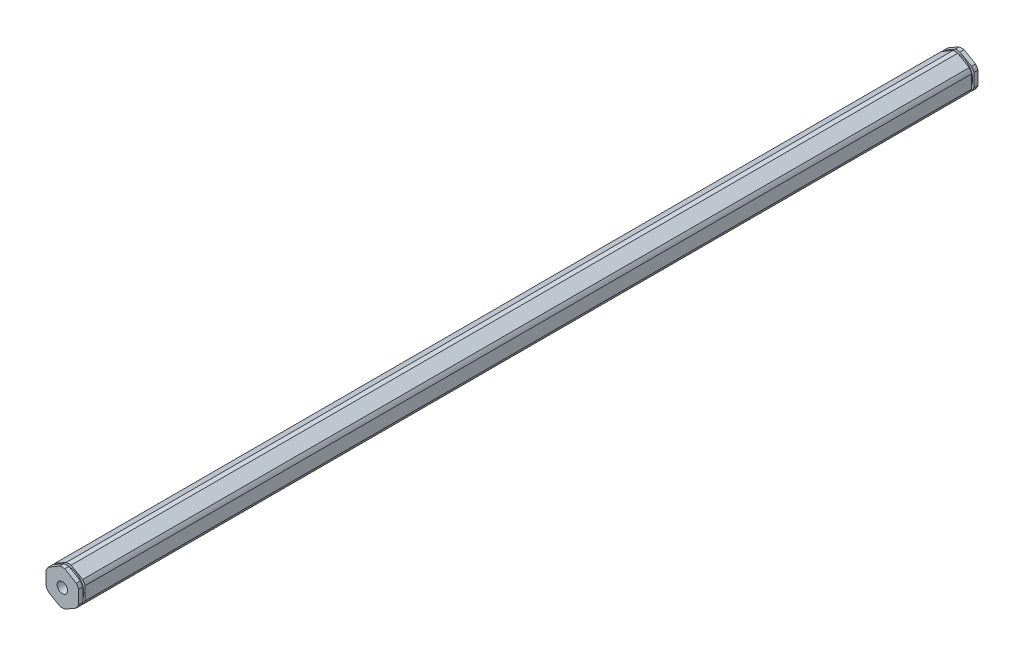
from build123d import *

# Parameters (mm, degrees)
BOSS_EXTRUDE1_DEPTH                  = 174.72025
F_10_32_TAPPED_HOLE1_D               = 4.0386
F_10_32_TAPPED_HOLE1_DEPTH           = 16.34744
F_10_32_TAPPED_HOLE1_TIP             = 1.213317848
F_10_32_TAPPED_HOLE1_ON_FACE_2_D     = 4.0386
F_10_32_TAPPED_HOLE1_ON_FACE_2_DEPTH = 16.34744
F_10_32_TAPPED_HOLE1_ON_FACE_2_TIP   = 1.213317848
SKETCH3_W                            = 0.889
SKETCH3_H                            = 1.0033


with BuildPart() as part:
    # Sketch1 → Boss-Extrude1 (new, symmetric)
    with BuildSketch(Plane.XY):
        with BuildLine():
            ThreePointArc((0.93173274, 6.79441227), (0, 6.858), (-0.93173274, 6.79441227))
            Line((-0.93173274, 6.79441227), (-5.41826726, 4.204110358))
            ThreePointArc((-5.41826726, 4.204110358), (-5.939202219, 3.429), (-6.35, 2.590301913))
            Line((-6.35, 2.590301913), (-6.35, -2.590301913))
            ThreePointArc((-6.35, -2.590301913), (-5.939202219, -3.429), (-5.41826726, -4.204110358))
            Line((-5.41826726, -4.204110358), (-0.93173274, -6.79441227))
            ThreePointArc((-0.93173274, -6.79441227), (0, -6.858), (0.93173274, -6.79441227))
            Line((0.93173274, -6.79441227), (5.41826726, -4.204110358))
            ThreePointArc((5.41826726, -4.204110358), (5.939202219, -3.429), (6.35, -2.590301913))
            Line((6.35, -2.590301913), (6.35, 2.590301913))
            ThreePointArc((6.35, 2.590301913), (5.939202219, 3.429), (5.41826726, 4.204110358))
            Line((5.41826726, 4.204110358), (0.93173274, 6.79441227))
        make_face()
    extrude(amount=BOSS_EXTRUDE1_DEPTH, both=True)

    # #10-32 Tapped Hole1
    with Locations(Plane.XY.offset(174.72025)):
        with Locations((0, 0)):
            Hole(F_10_32_TAPPED_HOLE1_D / 2, depth=F_10_32_TAPPED_HOLE1_DEPTH)
            with Locations((0, 0, -(F_10_32_TAPPED_HOLE1_DEPTH + F_10_32_TAPPED_HOLE1_TIP / 2))):  # 118° drill point
                Cone(0, F_10_32_TAPPED_HOLE1_D / 2, F_10_32_TAPPED_HOLE1_TIP, mode=Mode.SUBTRACT)

    # #10-32 Tapped Hole1 on face 2
    with Locations(Plane(origin=(0, 0, -174.72025), x_dir=(-1, 0, 0), z_dir=(0, 0, -1))):
        with Locations((0, 0)):
            Hole(F_10_32_TAPPED_HOLE1_ON_FACE_2_D / 2, depth=F_10_32_TAPPED_HOLE1_ON_FACE_2_DEPTH)
            with Locations((0, 0, -(F_10_32_TAPPED_HOLE1_ON_FACE_2_DEPTH + F_10_32_TAPPED_HOLE1_ON_FACE_2_TIP / 2))):  # 118° drill point
                Cone(0, F_10_32_TAPPED_HOLE1_ON_FACE_2_D / 2, F_10_32_TAPPED_HOLE1_ON_FACE_2_TIP, mode=Mode.SUBTRACT)

    # Sketch3 → Cut-Revolve1 (revolve, cut)
    with BuildSketch(Plane(origin=(0, 0, 0), x_dir=(0, 0, -1), z_dir=(1, 0, 0))):
        with Locations((-172.68825, 6.35635)):
            Rectangle(SKETCH3_W, SKETCH3_H)
    cut_revolve1 = revolve(axis=Axis((0, 0, 175.157387885), (0, 0, -1)), mode=Mode.SUBTRACT)

    # Mirror1: Cut-Revolve1 across plane
    add(cut_revolve1.mirror(Plane.XY), mode=Mode.SUBTRACT)


solid = part.part
